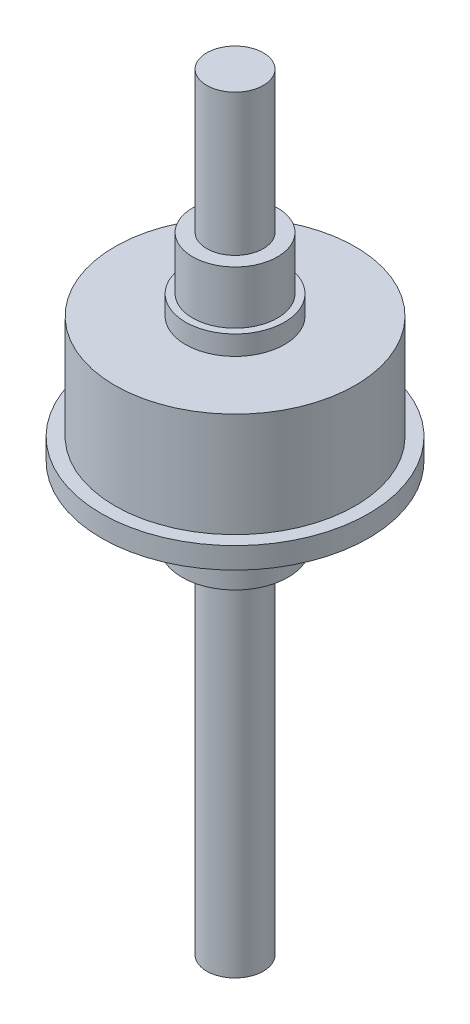
from build123d import *


with BuildPart() as part:
    # Sketch2 → Revolve1 (revolve)
    with BuildSketch(Plane.XY):
        Polygon((0, 0), (-4, 0), (-4, -20), (-6, -20), (-6, -27.5), (-7, -27.5), (-7, -30.25), (-17, -30.25), (-17, -45.01), (-18.9, -45.01), (-18.9, -48.01), (-10, -48.01), (-10, -50.51), (-7.5, -50.51), (-7.5, -58.51), (-4, -58.51), (-4, -108.51), (0, -108.51), align=None)
    revolve(axis=Axis((0, 40.033449689, 0), (0, -1, 0)))


solid = part.part
